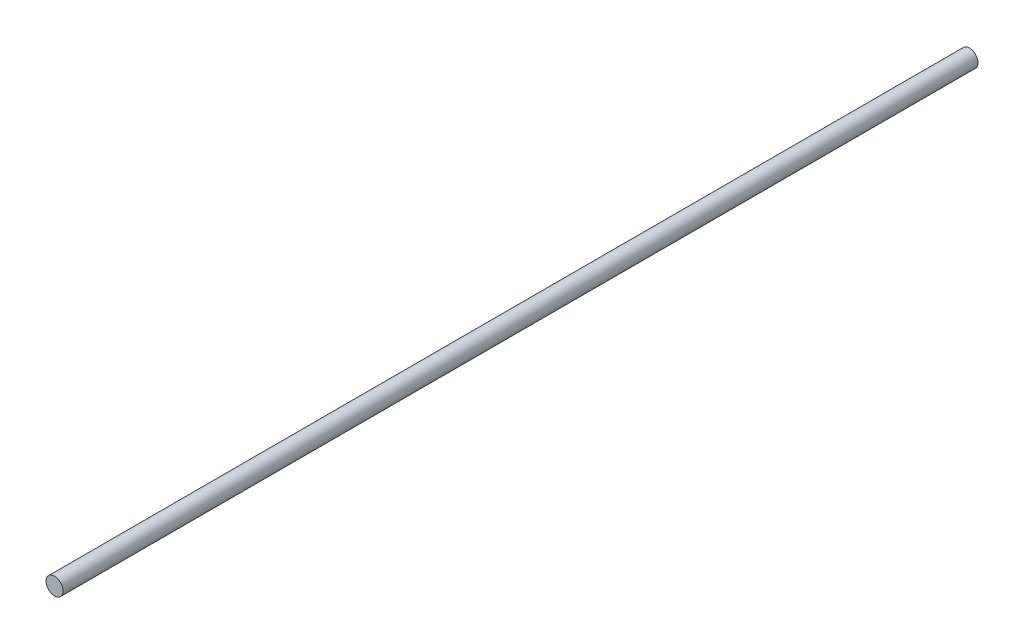
from build123d import *

# Parameters (mm, degrees)
SKETCH2_W = 427.6
SKETCH2_H = 4


with BuildPart() as part:
    # Sketch2 → Revolve1 (revolve)
    with BuildSketch(Plane(origin=(0, 0, 0), x_dir=(0, 0, -1), z_dir=(1, 0, 0))):
        with Locations((213.8, 2)):
            Rectangle(SKETCH2_W, SKETCH2_H)
    revolve(axis=Axis((0, 0, 0), (0, 0, -1)))


solid = part.part
